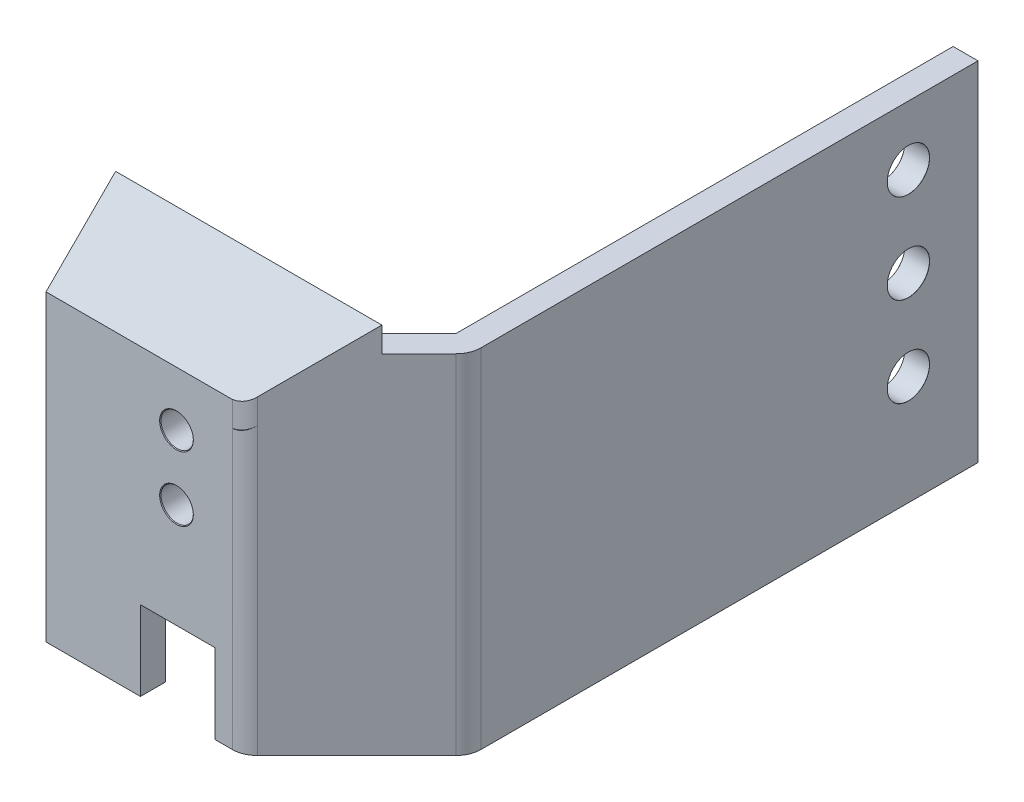
from build123d import *

# Parameters (mm, degrees)
ESBO_O15_W                        = 200
ESBO_O15_H                        = 140
FLANGE_BASE3_DEPTH                = 10
RESSALTO_EXTRUS_O3_DEPTH          = 140
CORTE_EXTRUS_O1_DEPTH             = 275.271763038
ESBO_O29_W                        = 30
ESBO_O29_H                        = 32
CORTE_EXTRUS_O2_DEPTH             = 313.609980647
FURO_COM_FOLGA_DE_M121_AT_2_COUNT = 2
FURO_COM_FOLGA_DE_M121_AT_2_PITCH = 26
RESSALTO_EXTRUS_O4_DEPTH          = 10
FURO_COM_FOLGA_DE_M161_AT_2_COUNT = 2
FURO_COM_FOLGA_DE_M161_AT_2_PITCH = 36
FURO_COM_FOLGA_DE_M161_AT_3_COUNT = 2
FURO_COM_FOLGA_DE_M161_AT_3_PITCH = 72


# Sheet-metal steps are written as plain solids
with BuildPart() as part:
    # Esboço15 → Flange-base3 (new body)
    with BuildSketch(Plane(origin=(0, 0, 0), x_dir=(0, 0, -1), z_dir=(1, 0, 0))):
        with Locations((100, 70)):
            Rectangle(ESBO_O15_W, ESBO_O15_H)
    extrude(amount=-FLANGE_BASE3_DEPTH)

    # Esboço22 → Ressalto-extrusão3 (add)
    with BuildSketch(Plane(origin=(0, 140, 0), x_dir=(1, 0, 0), z_dir=(0, 1, 0))):
        with BuildLine():
            Line((-10, 0), (-50, -40))
            Line((-50, -40), (-125, -40))
            Line((-125, -40), (-125, -50))
            Line((-125, -50), (-50, -50))
            ThreePointArc((-50, -50), (-46.173165676, -49.238795325), (-42.928932188, -47.071067812))
            Line((-42.928932188, -47.071067812), (-2.928932188, -7.071067812))
            ThreePointArc((-2.928932188, -7.071067812), (-0.761204675, -3.826834324), (0, 0))
            Line((0, 0), (-10, 0))
        make_face()
    extrude(amount=-RESSALTO_EXTRUS_O3_DEPTH)

    # Esboço28 → Corte-extrusão1 (cut, through all)
    with BuildSketch(Plane(origin=(0, 0, 0), x_dir=(0, 0, -1), z_dir=(1, 0, 0))):
        Polygon((-40, 122), (-22, 140), (-40, 140), (-50, 140), (-50, 112), align=None)
    extrude(amount=-CORTE_EXTRUS_O1_DEPTH, mode=Mode.SUBTRACT)

    # Esboço29 → Corte-extrusão2 (cut, through all)
    with BuildSketch(Plane.XY.offset(50)):
        with Locations((-72, 16)):
            Rectangle(ESBO_O29_W, ESBO_O29_H)
    extrude(amount=-CORTE_EXTRUS_O2_DEPTH, mode=Mode.SUBTRACT)

    # Esboço32 → Furo com folga de M121 (revolve, cut)
    with BuildSketch(Plane(origin=(-72.5, 100, 50), x_dir=(0, -1, 0), z_dir=(1, 0, 0))):
        Polygon((0, 0), (0, 10), (6.525, 10), (6.5, 9.975), (6.5, 0.275), (6.775, 0), align=None)
    furo_com_folga_de_m121 = revolve(axis=Axis((-72.5, 100, 56.35), (0, 0, -1)), mode=Mode.SUBTRACT)

    # Furo com folga de M121 at 2: Furo com folga de M121 ×2
    with Locations(*[(0, -i * FURO_COM_FOLGA_DE_M121_AT_2_PITCH, 0) for i in range(1, FURO_COM_FOLGA_DE_M121_AT_2_COUNT)]):
        add(furo_com_folga_de_m121, mode=Mode.SUBTRACT)

    # 3DSketch1 → Ressalto-extrusão4 (add, along a direction that is not the sketch's normal)
    with BuildSketch(Plane(origin=(-32, 140, 22), x_dir=(-0.9200708084976427, -0.27701056599928864, 0.2770105659992915), z_dir=(0, -0.7071067811865503, -0.7071067811865448))):
        with BuildLine():
            Line((0, 0), (85.56658519, 36.43294524))
            Line((85.56658519, 36.43294524), (101.079176886, 0))
            Line((101.079176886, 0), (32.073866249, -29.381407452))
            ThreePointArc((32.073866249, -29.381407452), (27.897170232, -29.738711394), (23.945292844, -28.34045504))
            Line((23.945292844, -28.34045504), (-13.011766157, -5.54021132))
            Line((-13.011766157, -5.54021132), (0, 0))
        make_face()
    extrude(amount=-RESSALTO_EXTRUS_O4_DEPTH, dir=(0, -1, 0))

    # Esboço33 → Furo com folga de M161 (revolve, cut)
    with BuildSketch(Plane(origin=(0, 116, -172), x_dir=(0, 0, -1), z_dir=(0, 1, 0))):
        Polygon((0, 0), (0, 10), (8.525, 10), (8.5, 9.975), (8.5, 0.025), (8.525, 0), align=None)
    furo_com_folga_de_m161 = revolve(axis=Axis((6.35, 116, -172), (-1, 0, 0)), mode=Mode.SUBTRACT)

    # Furo com folga de M161 at 2: Furo com folga de M161 ×2
    with Locations(*[(0, -i * FURO_COM_FOLGA_DE_M161_AT_2_PITCH, 0) for i in range(1, FURO_COM_FOLGA_DE_M161_AT_2_COUNT)]):
        add(furo_com_folga_de_m161, mode=Mode.SUBTRACT)

    # Furo com folga de M161 at 3: Furo com folga de M161 ×2
    with Locations(*[(0, -i * FURO_COM_FOLGA_DE_M161_AT_3_PITCH, 0) for i in range(1, FURO_COM_FOLGA_DE_M161_AT_3_COUNT)]):
        add(furo_com_folga_de_m161, mode=Mode.SUBTRACT)


solid = part.part
